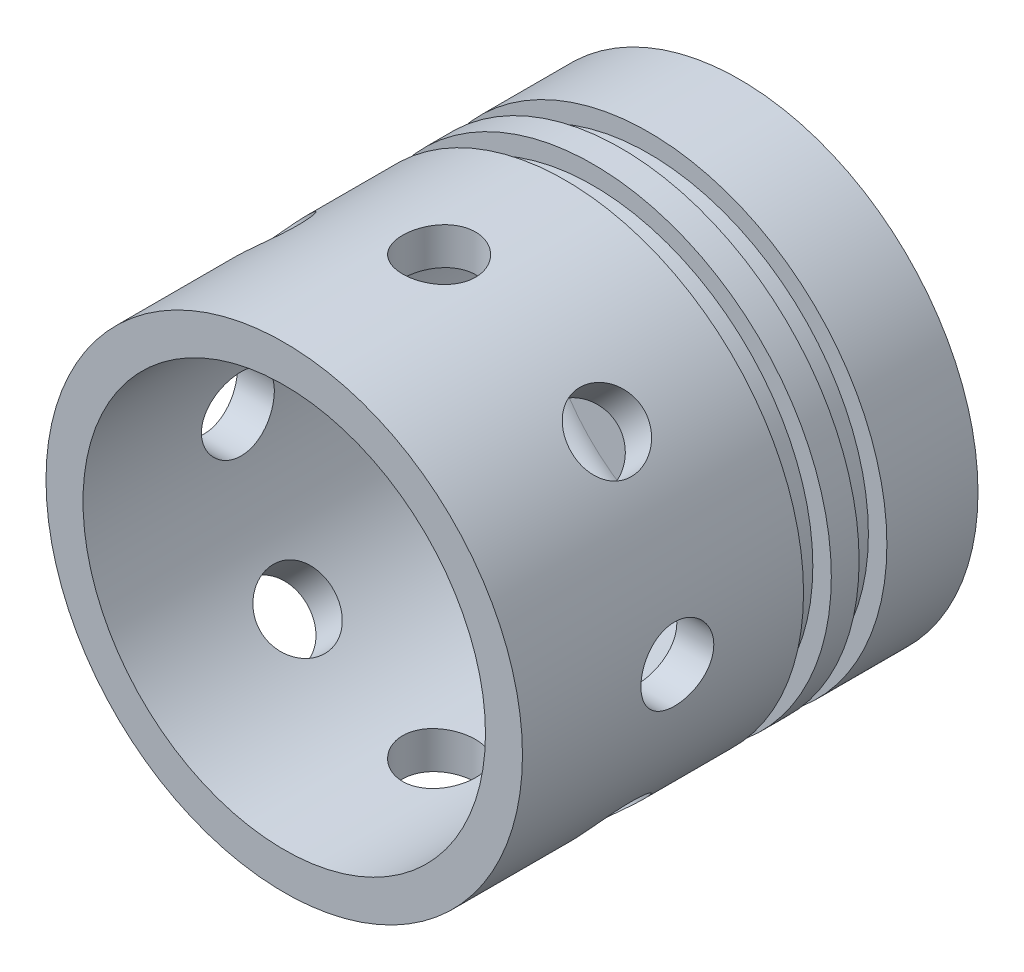
from build123d import *

# Parameters (mm, degrees)
MATRIZC1_COUNT = 8


# Read off the part's stored shape, not the designer's step: Revolución1
with BuildPart() as part:
    # Revolución1 outline → Revolución1 (revolve)
    with BuildSketch(Plane.XZ):
        with BuildLine():
            Line((24.1193, -30.85), (26.1493, -30.85))
            Line((26.1493, -30.85), (26.1493, 0))
            Line((26.1493, 0), (22.0893, 0))
            Line((22.0893, 0), (22.0893, -44.94))
            ThreePointArc((22.0893, -44.94), (21.345351224, -46.736051224), (19.5493, -47.48))
            Line((19.5493, -47.48), (0, -47.48))
            Line((0, -47.48), (0, -50))
            Line((0, -50), (26.1493, -50))
            Line((26.1493, -50), (26.1493, -40))
            Line((26.1493, -40), (24.1193, -40))
            Line((24.1193, -40), (24.1193, -36.95))
            Line((24.1193, -36.95), (26.1493, -36.95))
            Line((26.1493, -36.95), (26.1493, -33.9))
            Line((26.1493, -33.9), (24.1193, -33.9))
            Line((24.1193, -33.9), (24.1193, -30.85))
        make_face()
    revolve(axis=Axis((0, 0, 0), (0, 0, 1)))

    # Croquis3 → Ø8.0mm Dowel Hole1 (revolve, cut)
    with BuildSketch(Plane(origin=(0, 26.1493, -17), x_dir=(0, 0, 1), z_dir=(1, 0, 0))):
        Polygon((0, 0), (0, 28.551742476), (4, 26.1483), (4, 0), align=None)
    f_8_0mm_dowel_hole1 = revolve(axis=Axis((0, 32.4993, -17), (0, -1, 0)), mode=Mode.SUBTRACT)

    # MatrizC1: Ø8.0mm Dowel Hole1 ×8 about axis
    matrizc1_axis = Axis((0, 0, 0), (0, 0, 1))
    for i in range(1, MATRIZC1_COUNT):
        add(f_8_0mm_dowel_hole1.rotate(matrizc1_axis, i * 360 / MATRIZC1_COUNT), mode=Mode.SUBTRACT)


solid = part.part
